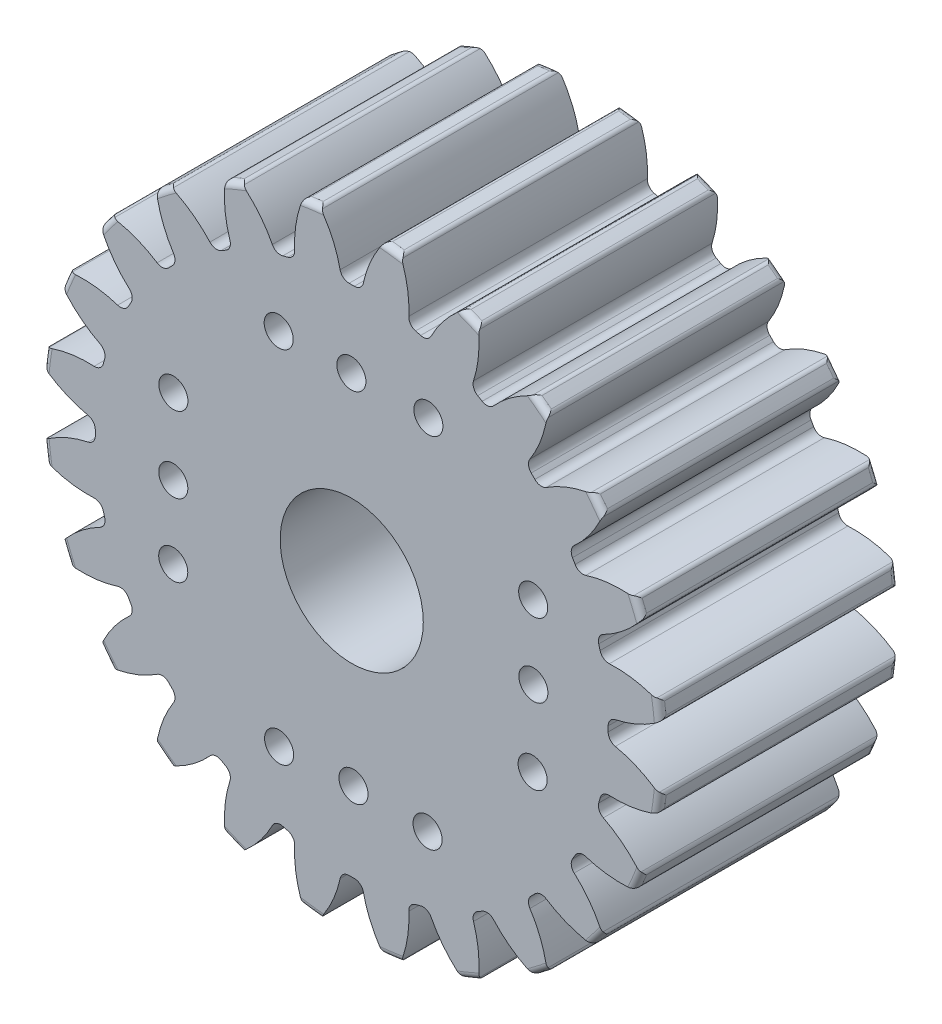
from build123d import *

# Parameters (mm, degrees)
FILLET2_R                = 0.260000001
CUT_EXTRUDE2_DEPTH       = 21.928449752
FILLET3_R                = 0.380000002
FILLET4_START            = -1
FILLET4_DEPTH            = 12
CIRPATTERN1_COUNT        = 24
FILLET3_OF_CIRPATTERN1_R = 0.380000002
CHAMFER1_SIZE            = 0.2
SKETCH8_R                = 10.260000001
CUT_EXTRUDE3_DEPTH       = 10
SKETCH9_R                = 7.250267554
BOSS_EXTRUDE1_DEPTH      = 10
SKETCH10_R               = 3
CUT_EXTRUDE4_DEPTH       = 10
SKETCH11_R               = 0.6096
CUT_EXTRUDE5_DEPTH       = 5


with BuildPart() as part:
    # Sketch4 → Revolve1 (revolve)
    with BuildSketch(Plane(origin=(0, 0, 0), x_dir=(0, 0, -1), z_dir=(1, 0, 0))):
        Polygon((-20, 4.000000001), (-20, 10), (-10, 10), (-10, 13.000000035), (0, 13.000000035), (0, 4.000000001), align=None)
    revolve(axis=Axis((0, 0, 10), (0, 0, 1)))

    # Fillet2
    fillet2_edges = [part.edges().sort_by_distance(p)[0] for p in [
        (0, -13.000000035, 0),
        (0, -13.000000035, 10),
        (0, -10, 10),
        (0, -10, 20),
    ]]
    fillet(fillet2_edges, radius=FILLET2_R)

    # Sketch7 → Cut-Extrude2 (cut, through all)
    with BuildSketch(Plane.XY.offset(10)):
        with BuildLine():
            ThreePointArc((-1.3451695, 12.930217319), (0, 13.000000035), (1.3451695, 12.930217319))
            ThreePointArc((1.3451695, 12.930217319), (0.750063507, 11.893267229), (0.429690186, 10.741408918))
            ThreePointArc((0.429690186, 10.741408918), (0, 10.749999963), (-0.429690186, 10.741408918))
            ThreePointArc((-0.429690186, 10.741408918), (-0.750063507, 11.893267229), (-1.3451695, 12.930217319))
        make_face()
    cut_extrude2 = extrude(amount=-CUT_EXTRUDE2_DEPTH, mode=Mode.SUBTRACT)

    # Fillet3
    fillet3_edges = [part.edges().sort_by_distance(p)[0] for p in [
        (-0.429690186, 10.741408918, 5),
        (0.429690186, 10.741408918, 5),
    ]]
    fillet(fillet3_edges, radius=FILLET3_R)

    # Fillet4: read off the stored shape, not the designer's step
    # Fillet4 outline → Fillet4 (cut)
    with BuildSketch(Plane.XY.offset(FILLET4_START)):
        with BuildLine():
            ThreePointArc((-1.3451695, 12.930217319), (-1.399931248, 12.924403019), (-1.454667874, 12.918356795))
            ThreePointArc((-1.454667874, 12.918356795), (-1.35627695, 12.903190195), (-1.279061203, 12.840352882))
            ThreePointArc((-1.279061203, 12.840352882), (-1.31185591, 12.885479404), (-1.3451695, 12.930217319))
        make_face()
        with BuildLine():
            ThreePointArc((1.279061203, 12.840352882), (1.35627695, 12.903190195), (1.454667874, 12.918356795))
            ThreePointArc((1.454667874, 12.918356795), (1.399931248, 12.924403019), (1.3451695, 12.930217319))
            ThreePointArc((1.3451695, 12.930217319), (1.31185591, 12.885479404), (1.279061203, 12.840352882))
        make_face()
    fillet4 = extrude(amount=FILLET4_DEPTH, mode=Mode.SUBTRACT)

    # CirPattern1: Cut-Extrude2, Fillet4 ×24 about axis
    cirpattern1_axis = Axis((0, 0, 0), (0, 0, 1))
    add([cut_extrude2.rotate(cirpattern1_axis, i * 360 / CIRPATTERN1_COUNT) for i in range(1, CIRPATTERN1_COUNT)], mode=Mode.SUBTRACT)
    add([fillet4.rotate(cirpattern1_axis, i * 360 / CIRPATTERN1_COUNT) for i in range(1, CIRPATTERN1_COUNT)], mode=Mode.SUBTRACT)

    # Fillet3 of CirPattern1
    fillet3_of_cirpattern1_edges = [part.edges().sort_by_distance(p)[0] for p in [
        (-3.195130047, 10.264192281, 5),
        (-2.365032352, 10.486616288, 5),
        (-5.742827076, 9.087487903, 5),
        (-4.998581843, 9.517178088, 5),
        (-7.89915993, 7.291486242, 5),
        (-7.291486242, 7.89915993, 5),
        (-9.517178088, 4.998581843, 5),
        (-9.087487903, 5.742827076, 5),
        (-10.486616288, 2.365032352, 5),
        (-10.264192281, 3.195130047, 5),
        (-10.741408918, -0.429690186, 5),
        (-10.741408918, 0.429690186, 5),
        (-10.264192281, -3.195130047, 5),
        (-10.486616288, -2.365032352, 5),
        (-9.087487903, -5.742827076, 5),
        (-9.517178088, -4.998581843, 5),
        (-7.291486242, -7.89915993, 5),
        (-7.89915993, -7.291486242, 5),
        (-4.998581843, -9.517178088, 5),
        (-5.742827076, -9.087487903, 5),
        (-2.365032352, -10.486616288, 5),
        (-3.195130047, -10.264192281, 5),
        (0.429690186, -10.741408918, 5),
        (-0.429690186, -10.741408918, 5),
        (3.195130047, -10.264192281, 5),
        (2.365032352, -10.486616288, 5),
        (5.742827076, -9.087487903, 5),
        (4.998581843, -9.517178088, 5),
        (7.89915993, -7.291486242, 5),
        (7.291486242, -7.89915993, 5),
        (9.517178088, -4.998581843, 5),
        (9.087487903, -5.742827076, 5),
        (10.486616288, -2.365032352, 5),
        (10.264192281, -3.195130047, 5),
        (10.741408918, 0.429690186, 5),
        (10.741408918, -0.429690186, 5),
        (10.264192281, 3.195130047, 5),
        (10.486616288, 2.365032352, 5),
        (9.087487903, 5.742827076, 5),
        (9.517178088, 4.998581843, 5),
        (7.291486242, 7.89915993, 5),
        (7.89915993, 7.291486242, 5),
        (4.998581843, 9.517178088, 5),
        (5.742827076, 9.087487903, 5),
        (2.365032352, 10.486616288, 5),
        (3.195130047, 10.264192281, 5),
    ]]
    fillet(fillet3_of_cirpattern1_edges, radius=FILLET3_OF_CIRPATTERN1_R)

    # Chamfer1
    chamfer1_edges = [part.edges().sort_by_distance(p)[0] for p in [
        (0, -4.000000001, 0),
        (0, -4.000000001, 20),
    ]]
    chamfer(chamfer1_edges, length=CHAMFER1_SIZE)

    # Sketch8 → Cut-Extrude3 (cut)
    with BuildSketch(Plane.XY.offset(20)):
        Circle(SKETCH8_R)
    extrude(amount=-CUT_EXTRUDE3_DEPTH, mode=Mode.SUBTRACT)

    # Sketch9 → Boss-Extrude1 (add)
    with BuildSketch(Plane.XY.offset(10)):
        Circle(SKETCH9_R)
    extrude(amount=-BOSS_EXTRUDE1_DEPTH)

    # Sketch10 → Cut-Extrude4 (cut)
    with BuildSketch(Plane.XY.offset(10)):
        Circle(SKETCH10_R)
    extrude(amount=-CUT_EXTRUDE4_DEPTH, mode=Mode.SUBTRACT)

    # Sketch11 → Cut-Extrude5 (cut)
    with BuildSketch(Plane.XY.offset(10)):
        with Locations((-0.014899268, 7.531253384)):
            Circle(SKETCH11_R)
        with Locations((-3.060789933, 7.535699939)):
            Circle(SKETCH11_R)
        with Locations((3.213300181, 7.522360272)):
            Circle(SKETCH11_R)
        with Locations((-7.475966289, 3.091946858)):
            Circle(SKETCH11_R)
        with Locations((-7.480496145, -0.084151894)):
            Circle(SKETCH11_R)
        with Locations((-7.481931511, -3.130636071)):
            Circle(SKETCH11_R)
        with Locations((-3.044000771, -7.541030952)):
            Circle(SKETCH11_R)
        with Locations((0.073818109, -7.40979592)):
            Circle(SKETCH11_R)
        with Locations((3.180141637, -7.511001571)):
            Circle(SKETCH11_R)
        with Locations((7.583675362, -3.145799098)):
            Circle(SKETCH11_R)
        with Locations((7.614697818, 0.044548245)):
            Circle(SKETCH11_R)
        with Locations((7.606756956, 3.12075441)):
            Circle(SKETCH11_R)
    extrude(amount=-CUT_EXTRUDE5_DEPTH, mode=Mode.SUBTRACT)


solid = part.part
